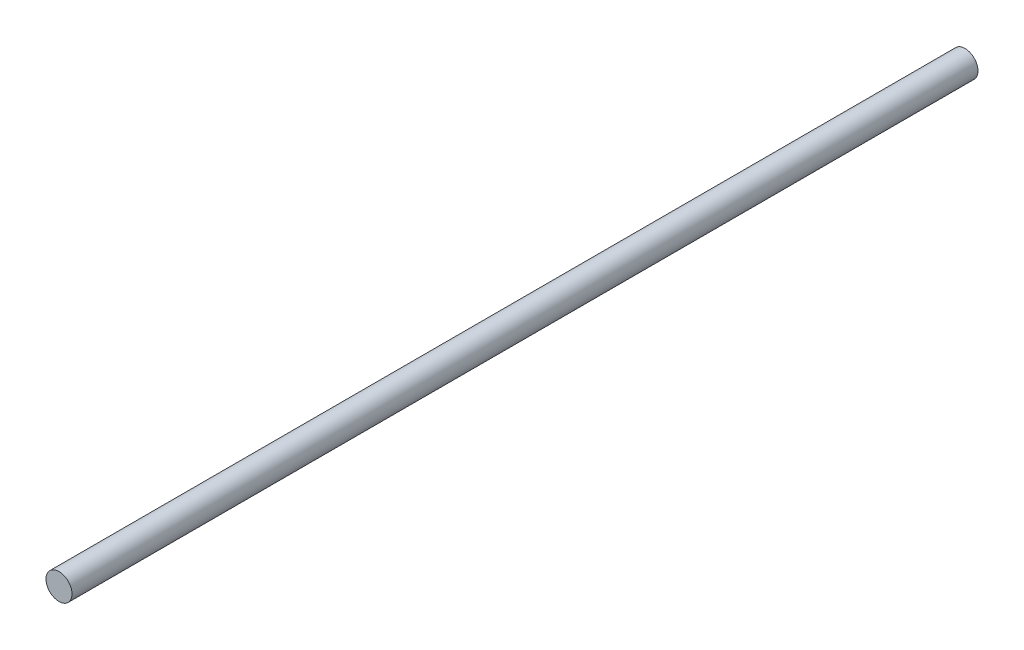
from build123d import *

# Parameters (mm, degrees)
SKETCH1_R           = 6
BOSS_EXTRUDE1_DEPTH = 209


with BuildPart() as part:
    # Sketch1 → Boss-Extrude1 (new, symmetric)
    with BuildSketch(Plane.XY):
        Circle(SKETCH1_R)
    extrude(amount=BOSS_EXTRUDE1_DEPTH, both=True)


solid = part.part
